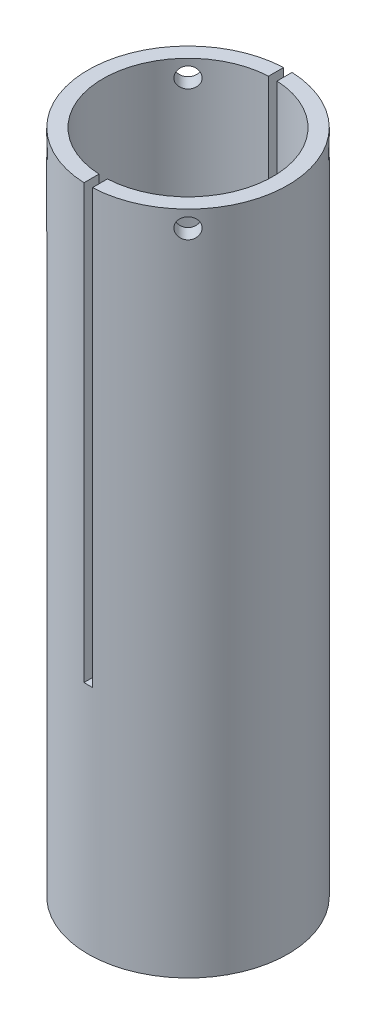
from build123d import *

# Parameters (mm, degrees)
SKETCH1_R                            = 3
SKETCH1_R_2                          = 2.55
BOSS_EXTRUDE1_DEPTH                  = 20
CUT_EXTRUDE1_DEPTH                   = 21.4450483
CUT_EXTRUDE1_DEPTH_BACK              = 21.4450483
SKETCH2_W                            = 0.254
SKETCH2_H                            = 13
F_0_6_0_6_DIAMETER_HOLE1_D           = 0.6
F_0_6_0_6_DIAMETER_HOLE1_ON_FACE_2_D = 0.6
F_0_6_0_6_DIAMETER_HOLE1_ON_FACE_3_D = 0.6
F_0_6_0_6_DIAMETER_HOLE1_ON_FACE_4_D = 0.6


with BuildPart() as part:
    # Sketch1 → Boss-Extrude1 (new body)
    with BuildSketch(Plane(origin=(0, 0, 0), x_dir=(1, 0, 0), z_dir=(0, 1, 0))):
        Circle(SKETCH1_R)
        Circle(SKETCH1_R_2, mode=Mode.SUBTRACT)
    extrude(amount=BOSS_EXTRUDE1_DEPTH)

    # Sketch2 → Cut-Extrude1 (cut, two sides: drawn at the far end of the back side and taken through both)
    with BuildSketch(Plane.XY.offset(-CUT_EXTRUDE1_DEPTH_BACK)):
        with Locations((0, 13.5)):
            Rectangle(SKETCH2_W, SKETCH2_H)
    extrude(amount=CUT_EXTRUDE1_DEPTH + CUT_EXTRUDE1_DEPTH_BACK, mode=Mode.SUBTRACT)

    # Ø0.6 (0.6) Diameter Hole1 (through all)
    with Locations(Plane(origin=(2.121320344, 19.5, 2.121320344), x_dir=(0.707106781187, 0, -0.707106781187), z_dir=(0.707106781187, 0, 0.707106781187))):
        with Locations((0, 0)):
            Hole(F_0_6_0_6_DIAMETER_HOLE1_D / 2)

    # Ø0.6 (0.6) Diameter Hole1 on face 2 (through all)
    with Locations(Plane(origin=(2.121320344, 19.5, -2.121320344), x_dir=(-0.707106781187, 0, -0.707106781187), z_dir=(0.707106781187, 0, -0.707106781187))):
        with Locations((0, 0)):
            Hole(F_0_6_0_6_DIAMETER_HOLE1_ON_FACE_2_D / 2)

    # Ø0.6 (0.6) Diameter Hole1 on face 3 (through all)
    with Locations(Plane(origin=(-2.121320344, 19.5, 2.121320344), x_dir=(0.707106781187, 0, 0.707106781187), z_dir=(-0.707106781187, 0, 0.707106781187))):
        with Locations((0, 0)):
            Hole(F_0_6_0_6_DIAMETER_HOLE1_ON_FACE_3_D / 2)

    # Ø0.6 (0.6) Diameter Hole1 on face 4 (through all)
    with Locations(Plane(origin=(-2.121320344, 19.5, -2.121320344), x_dir=(-0.707106781187, 0, 0.707106781187), z_dir=(-0.707106781187, 0, -0.707106781187))):
        with Locations((0, 0)):
            Hole(F_0_6_0_6_DIAMETER_HOLE1_ON_FACE_4_D / 2)


solid = part.part
